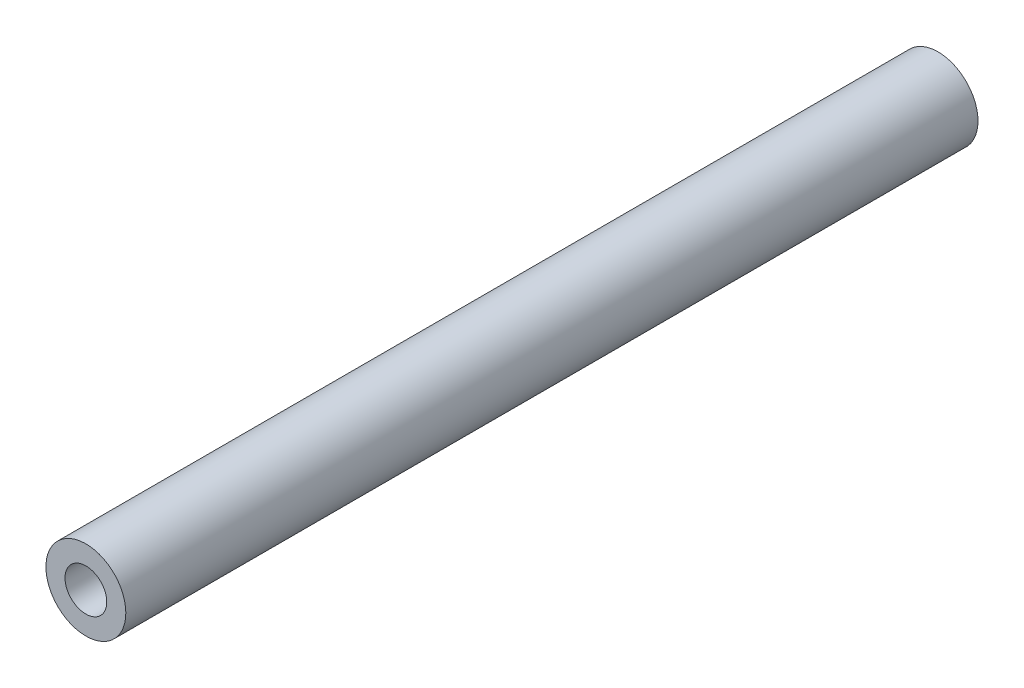
from build123d import *

# Parameters (mm, degrees)
SKETCH1_R           = 4.7625
SKETCH1_R_2         = 2.4892
BOSS_EXTRUDE1_DEPTH = 101.6


with BuildPart() as part:
    # Sketch1 → Boss-Extrude1 (new body)
    with BuildSketch(Plane.XY):
        Circle(SKETCH1_R)
        Circle(SKETCH1_R_2, mode=Mode.SUBTRACT)
    extrude(amount=BOSS_EXTRUDE1_DEPTH)


solid = part.part
